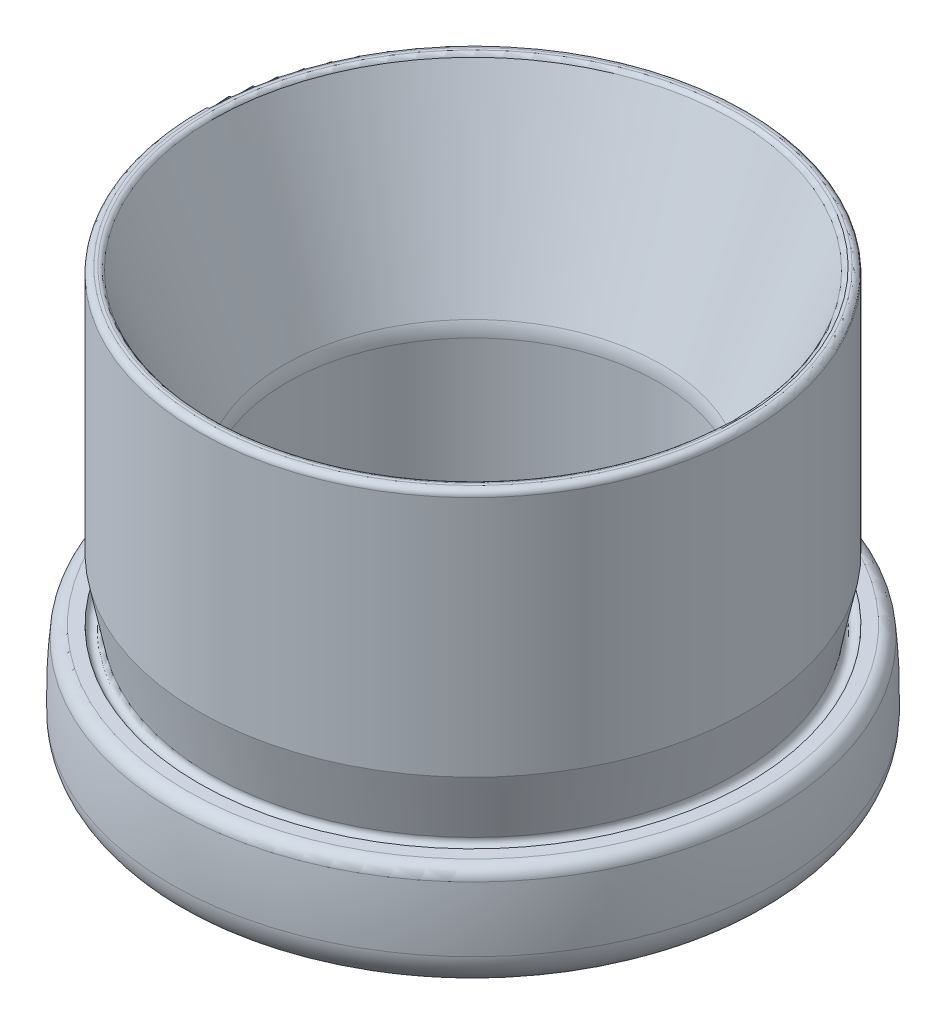
from build123d import *


with BuildPart() as part:
    # Szkic1 → Obrót1 (revolve)
    with BuildSketch(Plane.XY):
        with BuildLine():
            Line((11.23576264, 39.541313272), (11.23576264, 20.041313272))
            Line((11.23576264, 20.041313272), (12.22586165, 15.140323173))
            ThreePointArc((12.22586165, 15.140323173), (11.7855145, 14.543794677), (11.23576264, 15.041313272))
            Line((11.23576264, 15.041313272), (10.232233864, 15.041313272))
            ThreePointArc((10.232233864, 15.041313272), (9.560668225, 14.782258338), (9.237047369, 14.139312455))
            ThreePointArc((9.237047369, 14.139312455), (9.06498415, 11.604335478), (9.047194414, 9.063588038))
            ThreePointArc((9.047194414, 9.063588038), (10.724723738, 6.440547776), (13.825882871, 6.718499002))
            Line((13.825882871, 6.718499002), (17.115271233, 9.142072832))
            ThreePointArc((17.115271233, 9.142072832), (18.013310565, 10.204258226), (18.33576264, 11.557305568))
            Line((18.33576264, 11.557305568), (18.33576264, 24.454641299))
            ThreePointArc((18.33576264, 24.454641299), (18.279993216, 25.030407152), (18.114758428, 25.584766252))
            Line((18.114758428, 25.584766252), (12.33715142, 39.791996599))
            ThreePointArc((12.33715142, 39.791996599), (12.189919644, 39.973181718), (11.966618649, 40.041313272))
            Line((11.966618649, 40.041313272), (11.73576264, 40.041313272))
            ThreePointArc((11.73576264, 40.041313272), (11.38220925, 39.894866662), (11.23576264, 39.541313272))
        make_face()
    revolve(axis=Axis((33.33576264, 21.041313272, 0), (0, 1, 0)))


solid = part.part
